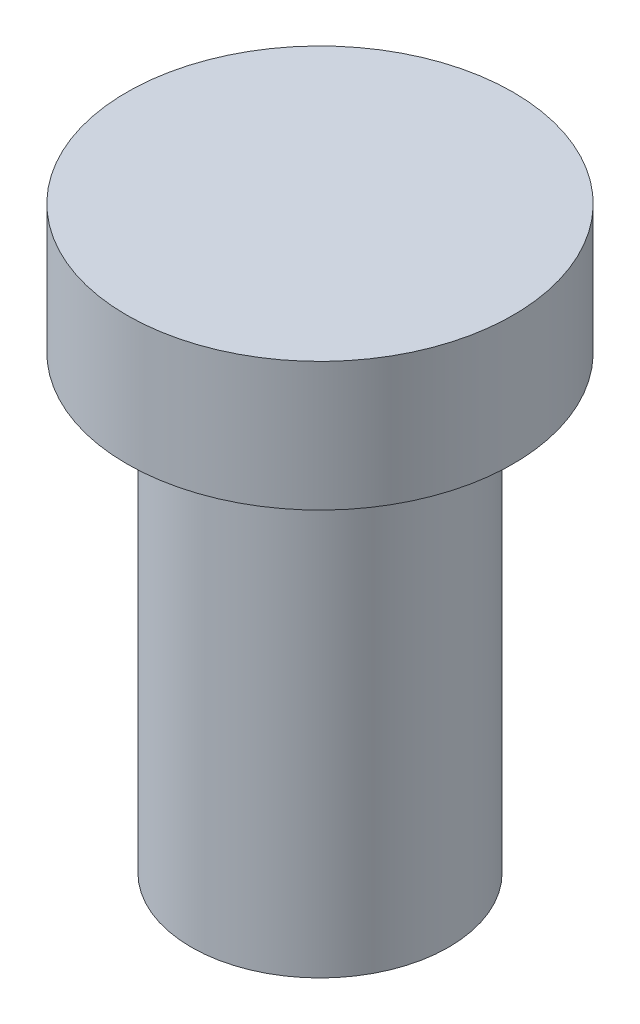
from build123d import *


with BuildPart() as part:
    # 스케치1 → 회전1 (revolve)
    with BuildSketch(Plane(origin=(0, 0, 0), x_dir=(0, 0, -1), z_dir=(1, 0, 0))):
        Polygon((0, 16.246180973), (3, 16.246180973), (3, 14.246180973), (2, 14.246180973), (2, 7.246180973), (0, 7.246180973), align=None)
    revolve(axis=Axis((0, 20.990482646, 0), (0, -1, 0)))


solid = part.part
